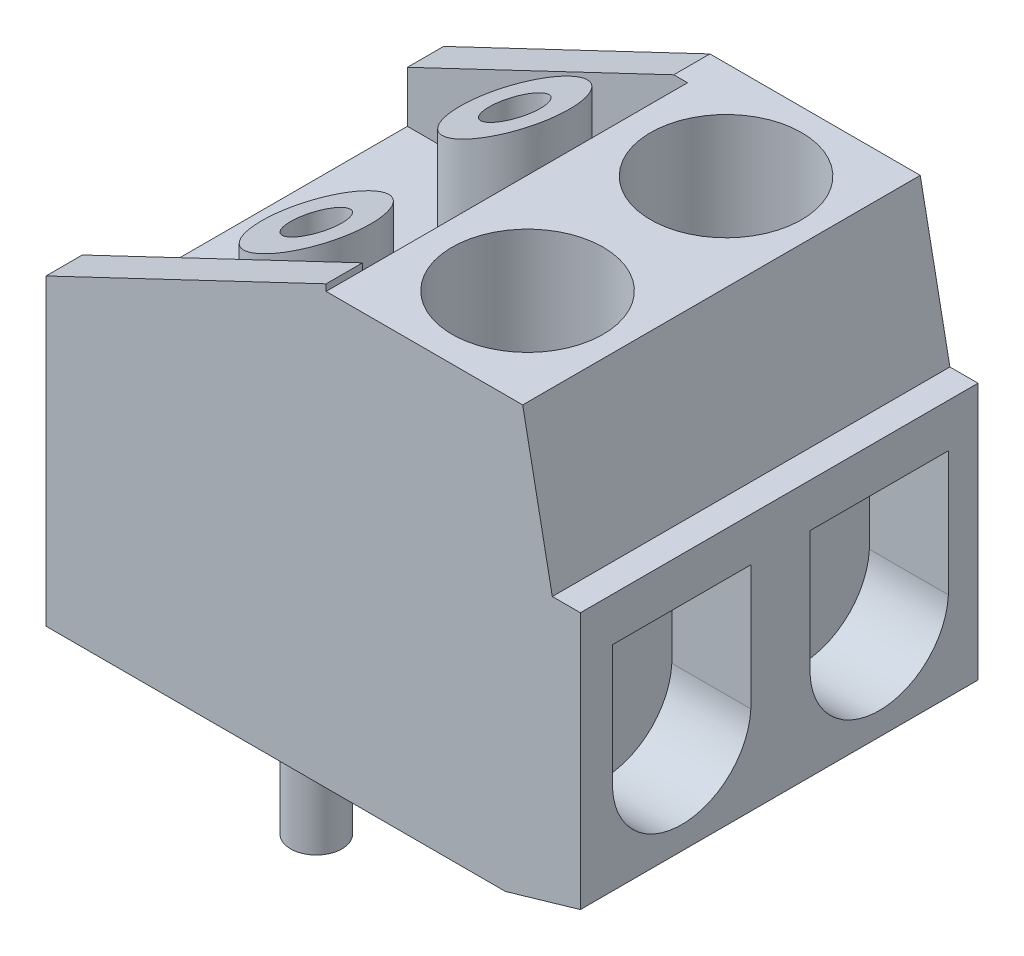
from build123d import *

# Parameters (mm, degrees)
EXTRUDE_1_DEPTH     = 7.5
CUT_EXTRUDE_START   = 10.884514
SKETCH_2_R          = 1.912136214
SKETCH_2_W          = 7.090261775
SKETCH_2_H          = 13.093091483
SKETCH_2_R_2        = 1.380933403
SKETCH_2_R_3        = 0.65
CUT_EXTRUDE_1_DEPTH = 4.5
CUT_EXTRUDE_2_DEPTH = 2
SKETCH_2_6_R        = 0.65
EXTRUDE_3_DEPTH     = 3.7
CUT_EXTRUDE_START_2 = -7.090262
SKETCH_4_R          = 1.411151221
SKETCH_4_R_2        = 0.775543873
CUT_EXTRUDE_3_DEPTH = 1.5
SKETCH_5_W          = 1.46101298
SKETCH_5_H          = 4.936486251
SKETCH_5_R          = 1.912136214
CUT_EXTRUDE_4_DEPTH = 18.867005063
EXTRUDE_START       = 1.643513749
EXTRUDE_4_DEPTH     = 0.92


# Read off the part's stored shape, not the designer's step: Бобышка-Вытянуть4
with BuildPart() as part:
    # Эскиз1 → Бобышка-Вытянуть1 (new, symmetric)
    with BuildSketch(Plane.XY):
        Polygon((-7.090261775, 0), (-7.090261775, 7.678308116), (-0.349095572, 10.884514209), (4.975912264, 10.884514209), (5.725642609, 7.058967063), (6.436925244, 7.058967063), (6.436925244, 0.551631224), (4.538262875, 0), align=None)
    extrude(amount=EXTRUDE_1_DEPTH, both=True)

    # Эскиз2 → Вырез-Вытянуть1 (cut)
    # profile 1 of 7: a face of its own
    with BuildSketch(Plane(origin=(0, 0, 0), x_dir=(1, 0, 0), z_dir=(0, 1, 0)).offset(CUT_EXTRUDE_START)):
        with Locations(Location((2.535525991, 5.024679523, 0), (0, 0, 90))):
            Circle(SKETCH_2_R)
    # profile 2 of 7: a face of its own
    with BuildSketch(Plane(origin=(0, 0, 0), x_dir=(1, 0, 0), z_dir=(0, 1, 0)).offset(CUT_EXTRUDE_START)):
        with Locations(Location((2.535525991, 0, 0), (0, 0, 90))):
            Circle(SKETCH_2_R)
    # profile 3 of 7: a face of its own
    with BuildSketch(Plane(origin=(0, 0, 0), x_dir=(1, 0, 0), z_dir=(0, 1, 0)).offset(CUT_EXTRUDE_START)):
        with Locations(Location((2.535525991, -5.063513749, 0), (0, 0, 90))):
            Circle(SKETCH_2_R)
    # profile 4 of 7: a face of its own
    with BuildSketch(Plane(origin=(0, 0, 0), x_dir=(1, 0, 0), z_dir=(0, 1, 0)).offset(CUT_EXTRUDE_START)):
        with Locations((-3.545130888, 0.03776166)):
            Rectangle(SKETCH_2_W, SKETCH_2_H)
        with Locations((-2.812641214, -5.063513749)):
            Circle(SKETCH_2_R_2, mode=Mode.SUBTRACT)
        with Locations((-2.812641214, 0)):
            Circle(SKETCH_2_R_2, mode=Mode.SUBTRACT)
        with Locations((-2.812641214, 5.024679523)):
            Circle(SKETCH_2_R_2, mode=Mode.SUBTRACT)
    # profile 5 of 7: a face of its own
    with BuildSketch(Plane(origin=(0, 0, 0), x_dir=(1, 0, 0), z_dir=(0, 1, 0)).offset(CUT_EXTRUDE_START)):
        with Locations((-2.812641214, -5.063513749)):
            Circle(SKETCH_2_R_3)
    # profile 6 of 7: a face of its own
    with BuildSketch(Plane(origin=(0, 0, 0), x_dir=(1, 0, 0), z_dir=(0, 1, 0)).offset(CUT_EXTRUDE_START)):
        with Locations((-2.812641214, 0)):
            Circle(SKETCH_2_R_3)
    # profile 7 of 7: a face of its own
    with BuildSketch(Plane(origin=(0, 0, 0), x_dir=(1, 0, 0), z_dir=(0, 1, 0)).offset(CUT_EXTRUDE_START)):
        with Locations((-2.812641214, 5.024679523)):
            Circle(SKETCH_2_R_3)
    extrude(amount=-CUT_EXTRUDE_1_DEPTH, mode=Mode.SUBTRACT)

    # Эскиз3 → Вырез-Вытянуть2 (cut)
    with BuildSketch(Plane(origin=(6.436925244, 0, 0), x_dir=(0, 0, -1), z_dir=(1, 0, 0))):
        with BuildLine():
            Line((1.75, 5.953109404), (-1.75, 5.953109404))
            Line((-1.75, 5.953109404), (-1.75, 2.794090542))
            ThreePointArc((-1.75, 2.794090542), (0, 1.131399682), (1.75, 2.794090542))
            Line((1.75, 2.794090542), (1.75, 5.953109404))
        make_face()
        with BuildLine():
            Line((3.25, 5.953109404), (3.25, 2.794090542))
            ThreePointArc((3.25, 2.794090542), (5, 1.131399682), (6.75, 2.794090542))
            Line((6.75, 2.794090542), (6.75, 5.953109404))
            Line((6.75, 5.953109404), (3.25, 5.953109404))
        make_face()
        with BuildLine():
            Line((-6.75, 5.953109404), (-6.75, 2.794090542))
            ThreePointArc((-6.75, 2.794090542), (-5, 1.131399682), (-3.25, 2.794090542))
            Line((-3.25, 2.794090542), (-3.25, 5.953109404))
            Line((-3.25, 5.953109404), (-6.75, 5.953109404))
        make_face()
    extrude(amount=-CUT_EXTRUDE_2_DEPTH, mode=Mode.SUBTRACT)

    # Эскиз2<6> → Бобышка-Вытянуть3 (add)
    with BuildSketch(Plane(origin=(0, 0, 0), x_dir=(1, 0, 0), z_dir=(0, 1, 0))):
        with Locations((-2.812641214, 5.024679523)):
            Circle(SKETCH_2_6_R)
        with Locations((-2.812641214, 0)):
            Circle(SKETCH_2_6_R)
        with Locations((-2.812641214, -5.063513749)):
            Circle(SKETCH_2_6_R)
    extrude(amount=-EXTRUDE_3_DEPTH)

    # Эскиз4 → Вырез-Вытянуть3 (cut)
    # profile 1 of 7: a face of its own
    with BuildSketch(Plane(origin=(0, 0, 0), x_dir=(0, 0, -1), z_dir=(1, 0, 0)).offset(CUT_EXTRUDE_START_2)):
        with Locations((5.042912497, 4.548641576)):
            Circle(SKETCH_4_R)
        with Locations((5.042912497, 4.548641576)):
            Circle(SKETCH_4_R_2, mode=Mode.SUBTRACT)
    # profile 2 of 7: a face of its own
    with BuildSketch(Plane(origin=(0, 0, 0), x_dir=(0, 0, -1), z_dir=(1, 0, 0)).offset(CUT_EXTRUDE_START_2)):
        with Locations((5.042912497, 4.548641576)):
            Circle(SKETCH_4_R_2)
    # profile 3 of 7: a face of its own
    with BuildSketch(Plane(origin=(0, 0, 0), x_dir=(0, 0, -1), z_dir=(1, 0, 0)).offset(CUT_EXTRUDE_START_2)):
        with Locations((0, 4.548641576)):
            Circle(SKETCH_4_R)
        with Locations((0, 4.548641576)):
            Circle(SKETCH_4_R_2, mode=Mode.SUBTRACT)
    # profile 4 of 7: a face of its own
    with BuildSketch(Plane(origin=(0, 0, 0), x_dir=(0, 0, -1), z_dir=(1, 0, 0)).offset(CUT_EXTRUDE_START_2)):
        with Locations((0, 4.548641576)):
            Circle(SKETCH_4_R_2)
    # profile 5 of 7: a face of its own
    with BuildSketch(Plane(origin=(0, 0, 0), x_dir=(0, 0, -1), z_dir=(1, 0, 0)).offset(CUT_EXTRUDE_START_2)):
        with Locations((-5.053327676, 4.548641576)):
            Circle(SKETCH_4_R)
        with Locations((-5.053327676, 4.548641576)):
            Circle(SKETCH_4_R_2, mode=Mode.SUBTRACT)
    # profile 6 of 7: a face of its own
    with BuildSketch(Plane(origin=(0, 0, 0), x_dir=(0, 0, -1), z_dir=(1, 0, 0)).offset(CUT_EXTRUDE_START_2)):
        with Locations((-5.053327676, 4.548641576)):
            Circle(SKETCH_4_R_2)
    # profile 7 of 7: a face of its own
    with BuildSketch(Plane(origin=(0, 0, 0), x_dir=(0, 0, -1), z_dir=(1, 0, 0)).offset(CUT_EXTRUDE_START_2)):
        Polygon((6.413915436, 2.503175658), (3.026112508, 2.503175658), (3.026112508, 5.869671649), (2.131221168, 5.869671649), (2.131221168, 2.503175658), (0.436105724, 2.500060238), (-1.258778832, 2.528210165), (-1.258778832, 0.951386535), (0.31785264, 0.932735686), (6.413915436, 0.932735686), align=None)
    extrude(amount=CUT_EXTRUDE_3_DEPTH, mode=Mode.SUBTRACT)

    # Эскиз5 → Вырез-Вытянуть4 (cut, through all)
    # profile 1 of 4: a face of its own
    with BuildSketch(Plane(origin=(0, 10.884514209, 0), x_dir=(1, 0, 0), z_dir=(0, 1, 0))):
        Polygon((0, -2.563513749), (-7.090261775, -2.563513749), (-7.090261775, -7.5), (-0.349095572, -7.5), (-0.349095572, -6.508784082), (0, -6.508784082), align=None)
    # profile 2 of 4: a face of its own
    with BuildSketch(Plane(origin=(0, 10.884514209, 0), x_dir=(1, 0, 0), z_dir=(0, 1, 0))):
        with Locations((5.706418754, -5.031756875)):
            Rectangle(SKETCH_5_W, SKETCH_5_H)
    # profile 3 of 4: a face of its own
    with BuildSketch(Plane(origin=(0, 10.884514209, 0), x_dir=(1, 0, 0), z_dir=(0, 1, 0))):
        Polygon((4.975912264, -2.563513749), (0, -2.563513749), (0, -6.508784082), (-0.349095572, -6.508784082), (-0.349095572, -7.5), (4.975912264, -7.5), align=None)
        with Locations((2.535525991, -5.063513749)):
            Circle(SKETCH_5_R, mode=Mode.SUBTRACT)
    # profile 4 of 4: a face of its own
    with BuildSketch(Plane(origin=(0, 10.884514209, 0), x_dir=(1, 0, 0), z_dir=(0, 1, 0))):
        with Locations((2.535525991, -5.063513749)):
            Circle(SKETCH_5_R)
    extrude(amount=-CUT_EXTRUDE_4_DEPTH, mode=Mode.SUBTRACT)

    # Бобышка-Вытянуть4 outline → Бобышка-Вытянуть4 (add)
    with BuildSketch(Plane.XY.offset(EXTRUDE_START)):
        Polygon((-7.090261775, 7.678308116), (-7.090261775, 6.384514209), (0, 6.384514209), (0, 11.050549627), align=None)
    extrude(amount=EXTRUDE_4_DEPTH)


solid = part.part
